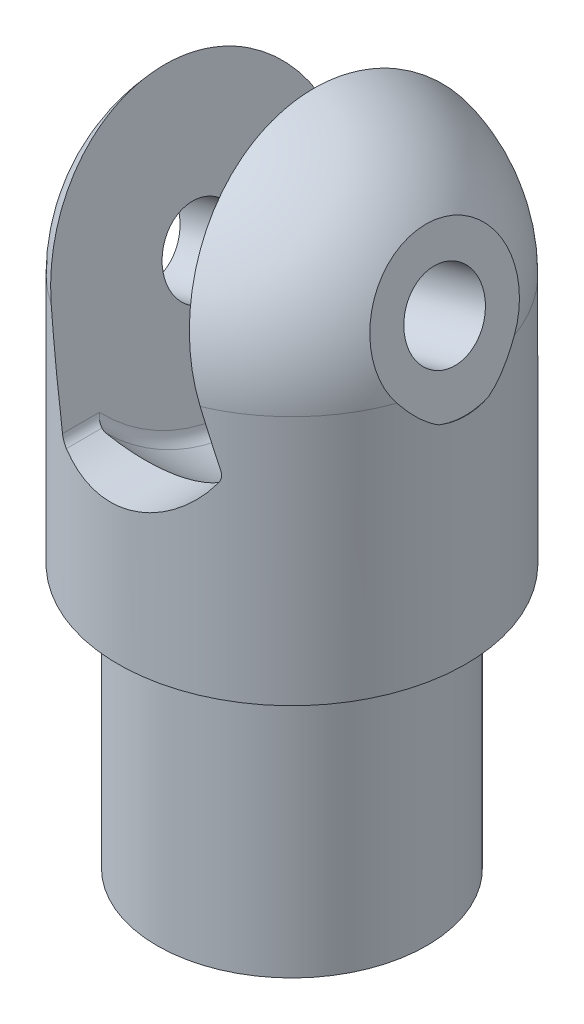
from build123d import *

# Parameters (mm, degrees)
SKETCH1_R                     = 12.9921
BOSS_EXTRUDE1_DEPTH           = 25.4
CUT_EXTRUDE1_DEPTH            = 105.060988801
CUT_EXTRUDE1_DEPTH_BACK       = 105.060988801
SKETCH3_R                     = 3.81
CUT_REVOLVE10_ANGLE           = 180
CUT_REVOLVE10_OTHER_WAY_ANGLE = 90
CUT_EXTRUDE4_DEPTH            = 32.004
FILLET1_R                     = 1.27
SKETCH15_R                    = 7.62
CUT_EXTRUDE5_DEPTH            = 10.16


with BuildPart() as part:
    # Sketch1 → Boss-Extrude1 (new body)
    with BuildSketch(Plane(origin=(0, 0, 0), x_dir=(1, 0, 0), z_dir=(0, 1, 0))):
        Circle(SKETCH1_R)
    extrude(amount=BOSS_EXTRUDE1_DEPTH)

    # Sketch2 → Revolve1 (revolve)
    with BuildSketch(Plane(origin=(0, 0, 0), x_dir=(0, 0, -1), z_dir=(1, 0, 0))):
        with BuildLine():
            Line((-16.764, 25.4), (-16.764, 49.53))
            ThreePointArc((-16.764, 49.53), (-11.85393808, 61.38393808), (0, 66.294))
            Line((0, 66.294), (0, 25.4))
            Line((0, 25.4), (-16.764, 25.4))
        make_face()
    revolve(axis=Axis((0, 25.4, 0), (0, 1, 0)))

    # Sketch3 → Cut-Extrude1 (cut, two sides: drawn at the far end of the back side and taken through both)
    with BuildSketch(Plane(origin=(-13.061360525, 98.275661096, 0), x_dir=(0, 0, -1), z_dir=(-0.9659258262890691, -0.25881904510251796, 0)).offset(-CUT_EXTRUDE1_DEPTH_BACK)):
        with Locations((0, 50.465221831)):
            Circle(SKETCH3_R)
    extrude(amount=CUT_EXTRUDE1_DEPTH + CUT_EXTRUDE1_DEPTH_BACK, mode=Mode.SUBTRACT)

    # Sketch11 → Cut-Revolve10 (revolve, cut)
    with BuildSketch(Plane.XY):
        with BuildLine():
            Line((-8.587080596, 47.229098689), (-12.761055304, 62.80658437))
            ThreePointArc((-12.761055304, 62.80658437), (-6.100746618, 66.905071675), (1.659803298, 67.870045747))
            Line((1.659803298, 67.870045747), (6.133628997, 51.173500936))
            Line((6.133628997, 51.173500936), (-8.587080596, 47.229098689))
        make_face()
    revolve(axis=Axis((17.609122795, 54.248350232, 0), (-0.9659258262890691, -0.258819045102518, 0)), revolution_arc=CUT_REVOLVE10_ANGLE, mode=Mode.SUBTRACT)

    # Sketch11 → Cut-Revolve10 other way (revolve, cut)
    with BuildSketch(Plane.XY):
        with BuildLine():
            Line((-8.587080596, 47.229098689), (-12.761055304, 62.80658437))
            ThreePointArc((-12.761055304, 62.80658437), (-6.100746618, 66.905071675), (1.659803298, 67.870045747))
            Line((1.659803298, 67.870045747), (6.133628997, 51.173500936))
            Line((6.133628997, 51.173500936), (-8.587080596, 47.229098689))
        make_face()
    revolve(axis=Axis((17.609122795, 54.248350232, 0), (0.9659258262890691, 0.258819045102518, 0)), revolution_arc=CUT_REVOLVE10_OTHER_WAY_ANGLE, mode=Mode.SUBTRACT)

    # Sketch13 → Cut-Revolve11 (revolve, cut)
    with BuildSketch(Plane.XY):
        with BuildLine():
            Line((-9.573181158, 50.909276087), (5.147528435, 54.853678335))
            Line((5.147528435, 54.853678335), (0.808561457, 71.046923549))
            ThreePointArc((0.808561457, 71.046923549), (-6.978979077, 70.669001302), (-13.912148136, 67.102521301))
            Line((-13.912148136, 67.102521301), (-9.573181158, 50.909276087))
        make_face()
    revolve(axis=Axis((-9.573181158, 50.909276087, 0), (0.9659258262890691, 0.25881904510251813, 0)), mode=Mode.SUBTRACT)

    # Sketch14 → Cut-Extrude4 (cut)
    with BuildSketch(Plane.XY):
        with BuildLine():
            Line((-8.587080596, 47.229098689), (-6.654726026, 40.017453258))
            ThreePointArc((-6.654726026, 40.017453258), (1.534355774, 38.896803098), (8.065983566, 43.961855506))
            Line((8.065983566, 43.961855506), (6.133628997, 51.173500936))
            Line((6.133628997, 51.173500936), (-8.587080596, 47.229098689))
        make_face()
    extrude(amount=CUT_EXTRUDE4_DEPTH, mode=Mode.SUBTRACT)

    # Fillet1
    fillet1_edges = [part.edges().sort_by_distance(p)[0] for p in [
        (-5.168586895, 34.471106511, -9.253521568),
        (-4.823660034, 33.183821941, 0),
        (-5.605202146, 36.100576812, 6.782727573),
        (-6.654726026, 40.017453258, 13.896075978),
        (8.065983566, 43.961855506, 13.550780739),
        (9.115507447, 40.044979059, 6.782727573),
        (10.046975054, 36.568694623, 0),
        (10.078314072, 36.451735818, -8.154680648),
    ]]
    fillet(fillet1_edges, radius=FILLET1_R)

    # Sketch15 → Cut-Extrude5 (cut)
    with BuildSketch(Plane(origin=(-2.338209593, -0.626521372, 0), x_dir=(0, 0, -1), z_dir=(-0.9659258262890691, -0.25881904510251796, 0))):
        with Locations((0, -47.842306176)):
            Circle(SKETCH15_R)
    cut_extrude5 = extrude(amount=CUT_EXTRUDE5_DEPTH, mode=Mode.SUBTRACT)

    # Mirror1: Cut-Extrude5 across plane
    add(cut_extrude5.mirror(Plane(origin=(12.3825, 3.317880875, 0), x_dir=(0, 0, 1), z_dir=(-0.9659258262890691, -0.25881904510251796, 0))), mode=Mode.SUBTRACT)


solid = part.part
